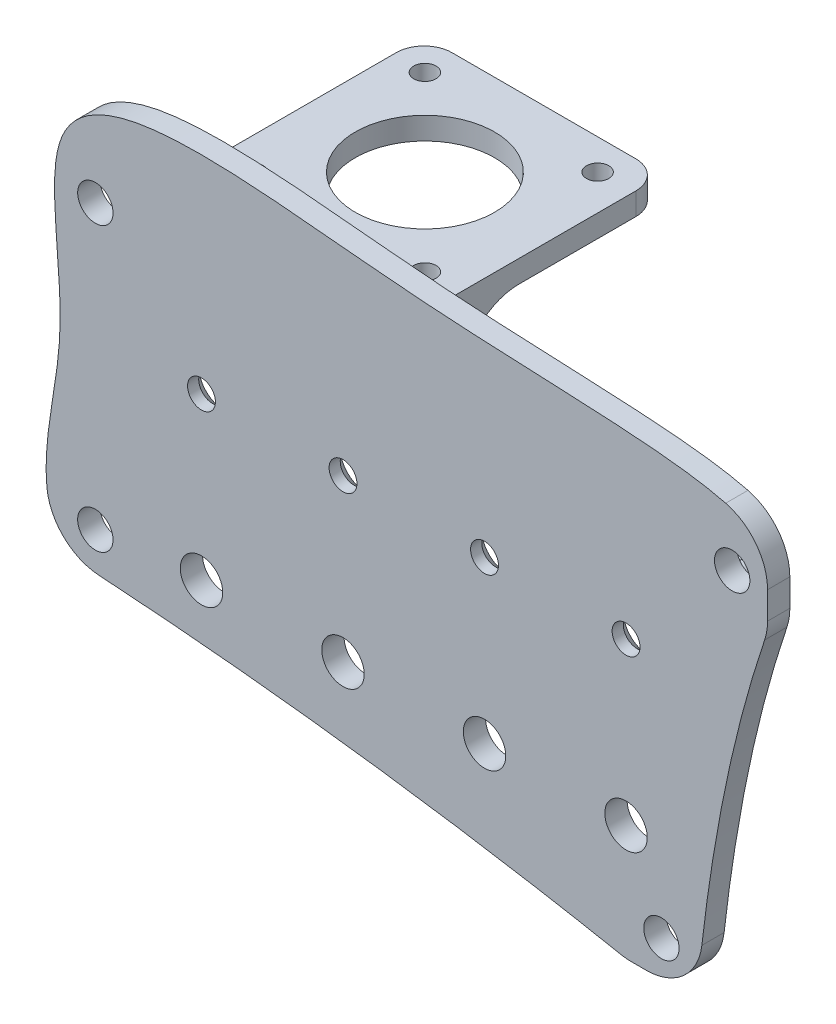
from build123d import *

# Parameters (mm, degrees)
SKETCH1_W           = 12.7
SKETCH1_H           = 12.7
SKETCH1_R           = 3.175
BOSS_EXTRUDE1_DEPTH = 4
FILLET1_R           = 10
SKETCH2_R           = 3.81
SKETCH2_R_2         = 2.5
CUT_EXTRUDE1_DEPTH  = 4
CHAMFER1_SIZE       = 2
BOSS_EXTRUDE2_DEPTH = 10
SKETCH4_R           = 1.25
BOSS_EXTRUDE3_DEPTH = 6
SKETCH5_W           = 43
SKETCH5_H           = 4
BOSS_EXTRUDE4_DEPTH = 45
SKETCH6_R           = 12.5
SKETCH6_R_2         = 2
CUT_EXTRUDE2_DEPTH  = 108.665859969
BOSS_EXTRUDE5_DEPTH = 2
LPATTERN1_COUNT     = 2
LPATTERN1_PITCH     = 41
FILLET2_R           = 10
FILLET3_R           = 5


with BuildPart() as part:
    # Sketch1 → Boss-Extrude1 (new body)
    # profile 1 of 5: a face of its own
    with BuildSketch(Plane.XY):
        with Locations((44.45, -38.1)):
            Rectangle(SKETCH1_W, SKETCH1_H)
        with Locations((44.45, -38.1)):
            Circle(SKETCH1_R, mode=Mode.SUBTRACT)
    # profile 2 of 5: a face of its own
    with BuildSketch(Plane.XY):
        with Locations((57.15, 25.4)):
            Rectangle(SKETCH1_W, SKETCH1_H)
        with Locations((57.15, 25.4)):
            Circle(SKETCH1_R, mode=Mode.SUBTRACT)
    # profile 3 of 5: a face of its own
    with BuildSketch(Plane.XY):
        with BuildLine():
            Line((38.1, -31.75), (50.8, -31.75))
            Line((50.8, -31.75), (50.8, -44.45))
            add(Edge.make_bspline(
                [(63.5, 19.05), (54.050232974, -8.232706042), (50.8, -44.45)],
                knots=[0, 0, 0, 1, 1, 1], degree=2))
            Line((63.5, 19.05), (50.8, 19.05))
            Line((50.8, 19.05), (50.8, 31.75))
            Line((50.8, 31.75), (63.5, 31.75))
            add(Edge.make_bspline(
                [(63.5, 31.75), (56.264765215, 38.750917428), (1.024250929, 36.1192622), (-58.313267073, 47.447066994), (-63.5, 31.75)],
                knots=[0, 0, 0, 0, 0.333440317, 0.666880634, 0.666880634, 0.666880634, 0.666880634], degree=3))
            add(Edge.make_bspline(
                [(-63.5, 31.75), (-65.884326315, 24.534103127), (-59.822582079, -0.957979633), (-68.847001316, -20.488368652), (-63.5, -31.75)],
                knots=[0.666880634, 0.666880634, 0.666880634, 0.666880634, 0.820162195, 1, 1, 1, 1], degree=3))
            add(Edge.make_bspline(
                [(-63.5, -31.75), (-12.259502937, -34.561880196), (38.1, -44.45)],
                knots=[0, 0, 0, 1, 1, 1], degree=2))
            Line((38.1, -44.45), (38.1, -31.75))
        make_face()
        with Locations((-57.15, -25.4)):
            Rectangle(SKETCH1_W, SKETCH1_H, mode=Mode.SUBTRACT)
        with Locations((-57.15, 25.4)):
            Rectangle(SKETCH1_W, SKETCH1_H, mode=Mode.SUBTRACT)
    # profile 4 of 5: a face of its own
    with BuildSketch(Plane.XY):
        with Locations((-57.15, -25.4)):
            Rectangle(SKETCH1_W, SKETCH1_H)
        with Locations((-57.15, -25.4)):
            Circle(SKETCH1_R, mode=Mode.SUBTRACT)
    # profile 5 of 5: a face of its own
    with BuildSketch(Plane.XY):
        with Locations((-57.15, 25.4)):
            Rectangle(SKETCH1_W, SKETCH1_H)
        with Locations((-57.15, 25.4)):
            Circle(SKETCH1_R, mode=Mode.SUBTRACT)
    extrude(amount=BOSS_EXTRUDE1_DEPTH)

    # Fillet1
    # the kernel refuses this fillet: 10 mm, written as the material it takes off along each edge
    with BuildSketch(Plane(origin=(-63.5, -31.75, 0), x_dir=(0.9982282944662612, -0.05950018594071388, 0), z_dir=(0, 0, 1))) as fillet1_piece_1:
        with BuildLine():
            CenterArc((7.023375519, 9.999888746), FILLET1_R, 188.80237236, 80.927359467)
            Line((-2.858844943, 8.469621204), (-3.056489352, 8.439015853))
            ThreePointArc((-3.056489352, 8.439015853), (-1.995723155, 4.044516596), (-0.17524552, -0.096379499))
            Line((-0.17524552, -0.096379499), (0.000942837, -0.199997778))
            ThreePointArc((0.000942837, -0.199997778), (3.488102637, -0.191775627), (6.975261589, -0.199997775))
            Line((6.975261589, -0.199997775), (6.976204999, 0))
        make_face()
    extrude(amount=4, mode=Mode.SUBTRACT)
    with BuildSketch(Plane(origin=(38.1, -44.45, 0), x_dir=(1, 0, 0), z_dir=(0, 0, 1))) as fillet1_piece_2:
        with BuildLine():
            CenterArc((0.969176776, 10), FILLET1_R, 258.965754628, 11.034245372)
            Line((-0.944779968, 0.184870374), (-0.983059103, -0.011432219))
            ThreePointArc((-0.983059103, -0.011432219), (-0.510766688, -0.103688929), (-0.038534332, -0.196252657))
            Line((-0.038534332, -0.196252657), (0, -0.2))
            Line((0, -0.2), (0.969176776, -0.2))
            Line((0.969176776, -0.2), (0.969176776, 0))
        make_face()
    extrude(amount=4, mode=Mode.SUBTRACT)
    with BuildSketch(Plane(origin=(50.8, -44.45, 0), x_dir=(-1, 0, 0), z_dir=(0, 0, 1))) as fillet1_piece_3:
        with BuildLine():
            CenterArc((9.031652527, -10), FILLET1_R, 90, 83.466839303)
            Line((-0.903409187, -8.862217622), (-1.102110422, -8.839461975))
            ThreePointArc((-1.102110422, -8.839461975), (-0.62351528, -4.413609763), (-0.199199459, 0.017876671))
            Line((-0.199199459, 0.017876671), (0, 0.2))
            Line((0, 0.2), (9.031652527, 0.2))
            Line((9.031652527, 0.2), (9.031652527, 0))
        make_face()
    extrude(amount=4, mode=Mode.SUBTRACT)
    with BuildSketch(Plane(origin=(63.5, 19.05, 0), x_dir=(-0.3232810569267654, -0.946302994939947, 0), z_dir=(0, 0, 1))) as fillet1_piece_4:
        with BuildLine():
            CenterArc((1.661260273, -9.999911311), FILLET1_R, 90.241308249, 18.620157575)
            Line((-1.571550296, -0.536881362), (-1.636206507, -0.347620763))
            Line((-1.636206507, -0.347620763), (-0.064656211, 0.189260599))
            Line((-0.064656211, 0.189260599), (0.000847582, 0.199998204))
            ThreePointArc((0.000847582, 0.199998204), (0.809570778, 0.198289881), (1.618301841, 0.199998226))
            Line((1.618301841, 0.199998226), (1.619144163, 0))
        make_face()
    extrude(amount=4, mode=Mode.SUBTRACT)
    with BuildSketch(Plane(origin=(63.5, 31.75, 0), x_dir=(0, -1, 0), z_dir=(0, 0, 1))) as fillet1_piece_5:
        with BuildLine():
            CenterArc((6.151180779, -10), FILLET1_R, 90, 75.600982511)
            Line((-3.534693477, -7.513267222), (-3.728410962, -7.463532566))
            ThreePointArc((-3.728410962, -7.463532566), (-2.411591734, -3.480031973), (-0.143729588, 0.13907482))
            Line((-0.143729588, 0.13907482), (0, 0.2))
            Line((0, 0.2), (6.151180779, 0.2))
            Line((6.151180779, 0.2), (6.151180779, 0))
        make_face()
    extrude(amount=4, mode=Mode.SUBTRACT)

    # Sketch2 → Cut-Extrude1 (cut)
    with BuildSketch(Plane(origin=(0, 0, 0), x_dir=(-1, 0, 0), z_dir=(0, 0, -1))):
        with Locations((-38.1, -23.75)):
            Circle(SKETCH2_R)
        with Locations((-12.7, -23.75)):
            Circle(SKETCH2_R)
        with Locations((12.7, -23.75)):
            Circle(SKETCH2_R)
        with Locations((38.1, -23.75)):
            Circle(SKETCH2_R)
        with Locations((-38.1, 5.22)):
            Circle(SKETCH2_R_2)
        with Locations((-12.7, 5.22)):
            Circle(SKETCH2_R_2)
        with Locations((12.7, 5.22)):
            Circle(SKETCH2_R_2)
        with Locations((38.1, 5.22)):
            Circle(SKETCH2_R_2)
    extrude(amount=-CUT_EXTRUDE1_DEPTH, mode=Mode.SUBTRACT)

    # Chamfer1
    chamfer1_edges = [part.edges().sort_by_distance(p)[0] for p in [
        (40.6, 5.22, 0),
        (15.2, 5.22, 0),
        (-10.2, 5.22, 0),
        (-35.6, 5.22, 0),
    ]]
    chamfer(chamfer1_edges, length=CHAMFER1_SIZE)

    # Sketch3 → Boss-Extrude2 (add)
    with BuildSketch(Plane(origin=(0, 0, 0), x_dir=(-1, 0, 0), z_dir=(0, 0, -1))):
        with BuildLine():
            Line((-47.141736788, 16.273908151), (-45.618529076, 14.75070044))
            Line((-45.618529076, 14.75070044), (-11.421892884, 14.75070044))
            Line((-11.421892884, 14.75070044), (-9.213629524, 16.958963799))
            Line((-9.213629524, 16.958963799), (1.244235083, 16.958963799))
            ThreePointArc((1.244235083, 16.958963799), (2.744235083, 15.458963799), (1.244235083, 13.958963799))
            Line((1.244235083, 13.958963799), (-7.970988837, 13.958963799))
            Line((-7.970988837, 13.958963799), (-10.179252196, 11.75070044))
            Line((-10.179252196, 11.75070044), (-46.861169764, 11.75070044))
            Line((-46.861169764, 11.75070044), (-49.263057132, 14.152587808))
            ThreePointArc((-49.263057132, 14.152587808), (-49.263057132, 16.273908151), (-47.141736788, 16.273908151))
        make_face()
    extrude(amount=BOSS_EXTRUDE2_DEPTH)

    # Sketch4 → Boss-Extrude3 (add)
    with BuildSketch(Plane(origin=(0, 0, 0), x_dir=(-1, 0, 0), z_dir=(0, 0, -1))):
        Polygon((-47.141736788, 16.273908151), (-42.469823915, 20.945821024), (-13.20048675, 20.945821024), (-9.213629524, 16.958963799), (-11.421892884, 14.75070044), (-45.618529076, 14.75070044), align=None)
        with Locations((-42.528356203, 17.55285)):
            Circle(SKETCH4_R, mode=Mode.SUBTRACT)
        with Locations((-14.601056203, 17.55285)):
            Circle(SKETCH4_R, mode=Mode.SUBTRACT)
    extrude(amount=BOSS_EXTRUDE3_DEPTH)

    # Sketch5 → Boss-Extrude4 (add)
    with BuildSketch(Plane(origin=(0, 0, 0), x_dir=(-1, 0, 0), z_dir=(0, 0, -1))):
        with Locations((25.65, 29.75)):
            Rectangle(SKETCH5_W, SKETCH5_H)
    extrude(amount=BOSS_EXTRUDE4_DEPTH)

    # Sketch6 → Cut-Extrude2 (cut, through all)
    with BuildSketch(Plane(origin=(0, 27.75, 0), x_dir=(-1, 0, 0), z_dir=(0, -1, 0))):
        with Locations(Location((26, 24, 0), (0, 0, 180))):
            Circle(SKETCH6_R)
        with Locations(Location((10.5, 39.5, 0), (0, 0, 180))):
            Circle(SKETCH6_R_2)
        with Locations(Location((41.5, 39.5, 0), (0, 0, 180))):
            Circle(SKETCH6_R_2)
        with Locations(Location((41.5, 8.5, 0), (0, 0, 180))):
            Circle(SKETCH6_R_2)
        with Locations(Location((10.5, 8.5, 0), (0, 0, 180))):
            Circle(SKETCH6_R_2)
    extrude(amount=-CUT_EXTRUDE2_DEPTH, mode=Mode.SUBTRACT)

    # Sketch7 → Boss-Extrude5 (add)
    with BuildSketch(Plane.ZY.offset(47.15)):
        Polygon((-14.493859768, 27.75), (0, 11.199228748), (0, 27.75), align=None)
    boss_extrude5 = extrude(amount=-BOSS_EXTRUDE5_DEPTH)

    # LPattern1: Boss-Extrude5 ×2
    with Locations(*[(i * LPATTERN1_PITCH, 0, 0) for i in range(1, LPATTERN1_COUNT)]):
        add(boss_extrude5)

    # Fillet2
    fillet2_edges = [part.edges().sort_by_distance(p)[0] for p in [
        (-46.15, 27.75, -14.493859768),
        (-46.15, 11.199228748, 0),
        (-5.15, 27.75, -14.493859768),
        (-5.15, 11.199228748, 0),
    ]]
    fillet(fillet2_edges, radius=FILLET2_R)

    # Fillet3
    fillet3_edges = [part.edges().sort_by_distance(p)[0] for p in [
        (-47.15, 29.75, -45),
        (-4.15, 29.75, -45),
    ]]
    fillet(fillet3_edges, radius=FILLET3_R)


solid = part.part
